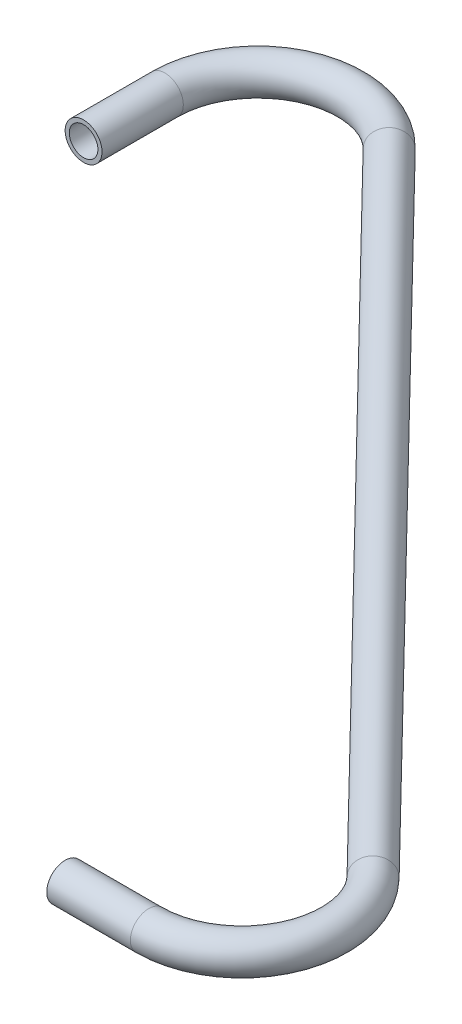
from build123d import *

# Parameters (mm, degrees)
SKETCH2_R   = 3.175
SKETCH2_R_2 = 2.4638


with BuildPart() as part:
    # Sweep-Thin1: sweep along a curve in space
    with BuildLine() as sweep_thin1_path:
        Line((0, 0, 0), (14.403152938, 0, 0))
        ThreePointArc((14.403152938, 0, 0), (29.14586495, 0, -9.782891144), (25.860283615, 0, -27.168444684))
        Line((25.860283615, 0, -27.168444684), (-81.374640553, 0, -137.175215914))
        ThreePointArc((-108.83177123, 0, -126.00677123), (-98.860283035, 0, -140.827602698), (-81.374640553, 0, -137.175215914))
        Line((-108.83177123, 0, -126.00677123), (-108.83177123, 0, -112.00677123))
    # Sketch2 → Sweep-Thin1 (sweep)
    with BuildSketch(Plane(origin=(0, 0, 0), x_dir=(0, 0, -1), z_dir=(1, 0, 0))):
        Circle(SKETCH2_R)
        Circle(SKETCH2_R_2, mode=Mode.SUBTRACT)
    sweep(path=sweep_thin1_path.line)


solid = part.part
